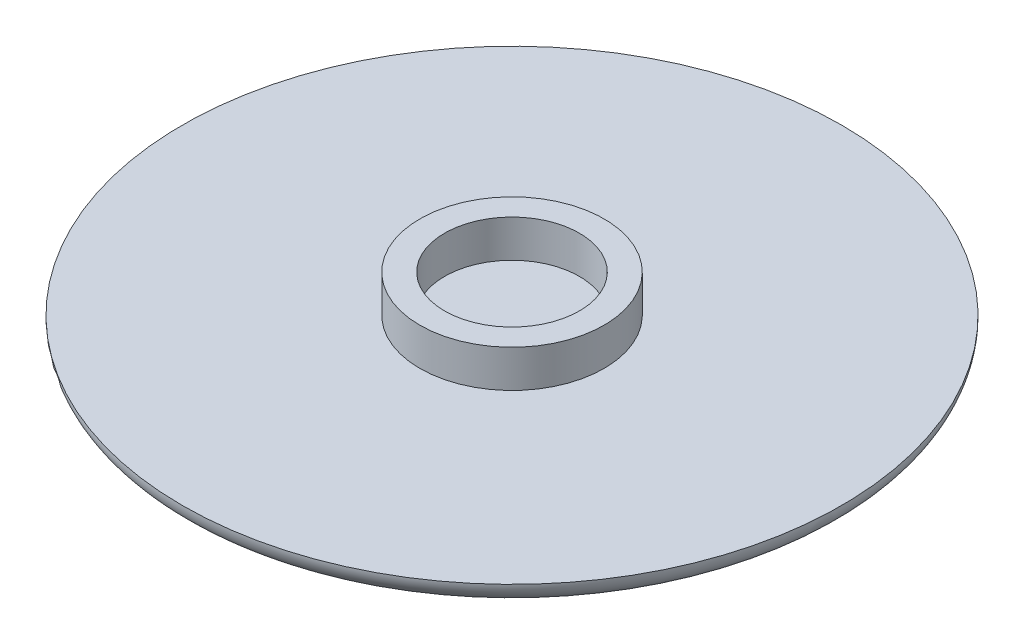
from build123d import *

# Parameters (mm, degrees)
SKETCH_1_R          = 12.3
SKETCH_1_R_2        = 9
EXTRUDE_1_DEPTH     = 5
SKETCH_2_R          = 44
EXTRUDE_2_DEPTH     = 3
FILLET_1_R          = 3
CUT_EXTRUDE_1_DEPTH = 0.4


with BuildPart() as part:
    # Эскиз1 → Бобышка-Вытянуть1 (new body)
    with BuildSketch(Plane(origin=(0, 0, 0), x_dir=(1, 0, 0), z_dir=(0, 1, 0))):
        with Locations(Location((0, 0, 0), (0, 0, 270))):
            Circle(SKETCH_1_R)
        with Locations(Location((0, 0, 0), (0, 0, 270))):
            Circle(SKETCH_1_R_2, mode=Mode.SUBTRACT)
    extrude(amount=EXTRUDE_1_DEPTH)

    # Эскиз2 → Бобышка-Вытянуть2 (add)
    with BuildSketch(Plane.XZ):
        with Locations(Location((0, 0, 0), (0, 0, 270))):
            Circle(SKETCH_2_R)
    extrude(amount=EXTRUDE_2_DEPTH)

    # Скругление1
    fillet_1_edges = [part.edges().sort_by_distance(p)[0] for p in [
        (0, -3, 44),
    ]]
    fillet(fillet_1_edges, radius=FILLET_1_R - 0.0001)  # a hair under: the kernel refuses the full size

    # Эскиз3 → Вырез-Вытянуть1 (cut)
    with BuildSketch(Plane.XZ.offset(3)):
        with BuildLine():
            Line((8.995970712, -6.104573863), (15.540441866, -6.809702068))
            add(Edge.make_bspline(
                [(15.540441866, -6.809702068), (15.412468117, -7.209291312), (15.154055197, -8.016167909), (14.613314091, -9.189585554), (13.958158021, -10.343258865), (13.207970677, -11.497332402), (12.335909119, -12.632612277), (11.33678469, -13.743257832), (10.235946519, -14.845807978), (9.032648574, -15.91638665), (7.753536664, -16.930703687), (6.377129387, -17.80304501), (4.944504921, -18.539269968), (3.454192561, -19.15568009), (1.899553784, -19.624607238), (0.282665391, -19.970371161), (-1.395976393, -20.169412876), (-2.535298753, -20.19445388), (-3.112402685, -20.207137965)],
                knots=[0, 0, 0, 0, 0.821440156, 1.658705401, 2.525323128, 3.419405186, 4.353419828, 5.32681938, 6.344399772, 7.404443113, 8.481060479, 9.538977106, 10.591299887, 11.633537695, 12.694215778, 13.768160887, 14.869500701, 16, 16, 16, 16], degree=3))
            add(Edge.make_bspline(
                [(-3.112402685, -20.207137965), (-3.830059973, -20.180219947), (-5.24950882, -20.126979006), (-7.333765847, -19.748485297), (-9.324321869, -19.100876457), (-11.205038798, -18.21140963), (-12.947033456, -17.089230598), (-14.454993346, -15.681556769), (-15.775431133, -14.076428854), (-16.836564852, -12.230966933), (-17.674056128, -10.211434225), (-18.260978719, -8.036915844), (-18.637890858, -5.732029495), (-18.680542171, -4.148625261), (-18.702346595, -3.339149183)],
                knots=[0, 0, 0, 0, 0.998551589, 1.975027533, 2.936744805, 3.903838964, 4.863557655, 5.807675034, 6.763178998, 7.745855275, 8.758641806, 9.797744155, 10.874151411, 12, 12, 12, 12], degree=3))
            add(Edge.make_bspline(
                [(-18.702346595, -3.339149183), (-18.694827115, -2.798940969), (-18.679761602, -1.716616884), (-18.527910505, -0.102284621), (-18.301586091, 1.502865479), (-17.965102533, 3.090290283), (-17.549772791, 4.670349499), (-17.029049457, 6.231978524), (-16.419967141, 7.784615504), (-15.720819637, 9.310739002), (-14.951153945, 10.78597136), (-14.104651779, 12.165779349), (-13.228965259, 13.463701063), (-12.281997416, 14.653281312), (-11.271614555, 15.73843901), (-10.215647458, 16.72916995), (-9.109657465, 17.6327847), (-7.937840655, 18.421008283), (-6.733157575, 19.121726424), (-5.503022782, 19.73623986), (-4.241088179, 20.242359886), (-2.95541361, 20.657688994), (-1.650714865, 20.995350946), (-0.320069938, 21.221805432), (1.034040545, 21.37348169), (1.947944187, 21.388084339), (2.407429046, 21.395426137)],
                knots=[0, 0, 0, 0, 1.075906032, 2.155611451, 3.227554832, 4.30373447, 5.38628686, 6.480642286, 7.581143633, 8.707391042, 9.82337293, 10.893692135, 11.930684225, 12.940768785, 13.919223559, 14.881988069, 15.823529777, 16.761054785, 17.692163021, 18.598508727, 19.497917784, 20.397951545, 21.288749041, 22.180057169, 23.084984307, 24, 24, 24, 24], degree=3))
            add(Edge.make_bspline(
                [(2.407429046, 21.395426137), (2.984709253, 21.38436262), (4.110243009, 21.362791879), (5.755422445, 21.146858145), (7.309280074, 20.798674498), (8.776183147, 20.306894686), (10.163630571, 19.698295383), (11.445405048, 18.914546867), (12.642602428, 18.007561118), (13.744215102, 16.970925789), (14.740391422, 15.815186826), (15.5940589, 14.539264454), (16.346732625, 13.178856469), (16.935563309, 11.70304546), (17.399883233, 10.131680694), (17.72749797, 8.457159294), (17.928240109, 6.684462125), (17.952122631, 5.468151048), (17.964320071, 4.846948573)],
                knots=[0, 0, 0, 0, 1.079196217, 2.10412856, 3.097265039, 4.052997914, 4.993829394, 5.924450447, 6.855882321, 7.798592485, 8.748507102, 9.702980304, 10.665060364, 11.651045023, 12.668191174, 13.725659051, 14.838433479, 16, 16, 16, 16], degree=3))
            add(Edge.make_bspline(
                [(17.964320071, 4.846948573), (17.939861422, 3.857360897), (17.890041697, 1.84167366), (17.596116304, -0.153181552), (17.446491546, -1.168676427)],
                knots=[0, 0, 0, 0, 0.981886135, 2, 2, 2, 2], degree=3))
            Line((17.446491546, -1.168676427), (-11.651064544, -1.168676427))
            add(Edge.make_bspline(
                [(-11.651064544, -1.168676427), (-11.757884651, -1.36504795), (-11.95927427, -1.735270255), (-12.188010225, -2.298230913), (-12.326177646, -2.83296849), (-12.346562226, -3.184220667), (-12.356192749, -3.350166811)],
                knots=[0, 0, 0, 0, 1.156942796, 2.181202349, 3.140724307, 4, 4, 4, 4], degree=3))
            add(Edge.make_bspline(
                [(-12.356192749, -3.350166811), (-12.34747649, -3.820530136), (-12.330558483, -4.733491811), (-12.207588937, -6.058525833), (-12.012779093, -7.30055293), (-11.73295496, -8.457242596), (-11.349108398, -9.521277255), (-10.912446511, -10.511594722), (-10.387891199, -11.419433456), (-9.762517234, -12.22046917), (-9.095103061, -12.940939566), (-8.37345163, -13.553599554), (-7.633662355, -14.094798444), (-6.845003469, -14.527977227), (-6.01676525, -14.853496387), (-5.158998119, -15.10327405), (-4.2632374, -15.248645974), (-3.652782517, -15.263647049), (-3.343772877, -15.271240529)],
                knots=[0, 0, 0, 0, 1.346284225, 2.613098929, 3.805631801, 4.942804233, 6.013450698, 7.039235158, 8.038108926, 9.00533571, 9.942442562, 10.84439418, 11.710848438, 12.56244313, 13.41163356, 14.253504373, 15.115931414, 16, 16, 16, 16], degree=3))
            add(Edge.make_bspline(
                [(-3.343772877, -15.271240529), (-2.749342022, -15.245702869), (-1.550628193, -15.194204288), (0.219580647, -14.702324431), (1.984521743, -13.976401138), (3.39348022, -13.111143469), (4.503332391, -12.310342129), (5.279497704, -11.607205665), (6.028705195, -10.857717747), (6.714675872, -10.028152313), (7.372080008, -9.148002655), (7.963425509, -8.192752467), (8.520742644, -7.181562683), (8.836014409, -6.467075917), (8.995970712, -6.104573863)],
                knots=[0, 0, 0, 0, 1.313044299, 2.647851039, 4.03980324, 5.527339259, 6.29475363, 7.066375866, 7.842396062, 8.63863277, 9.446691243, 10.272184996, 11.123375662, 12, 12, 12, 12], degree=3))
        make_face()
        with BuildLine():
            Line((-10.57133698, 3.767221009), (11.585113341, 3.767221009))
            add(Edge.make_bspline(
                [(11.585113341, 3.767221009), (11.593025495, 4.083048202), (11.606273104, 4.611849202), (11.614751545, 5.140746771), (11.618166225, 5.353759471)],
                knots=[0, 0, 0, 0, 1.194503009, 2, 2, 2, 2], degree=3))
            add(Edge.make_bspline(
                [(11.618166225, 5.353759471), (11.607865414, 5.787266581), (11.587754302, 6.633637755), (11.485258286, 7.865088987), (11.282712763, 9.016930024), (11.014497534, 10.093427235), (10.643340787, 11.084224083), (10.22296171, 12.00905194), (9.693440715, 12.841121184), (9.10342503, 13.5981791), (8.450495006, 14.275095215), (7.747736216, 14.858424007), (6.995642953, 15.349517378), (6.205542288, 15.762387273), (5.357586525, 16.065155124), (4.475125766, 16.303564325), (3.542488324, 16.434420376), (2.907267946, 16.451055439), (2.583711097, 16.459528702)],
                knots=[0, 0, 0, 0, 1.288915635, 2.516454775, 3.668675548, 4.762204166, 5.808675246, 6.809806692, 7.776046417, 8.732555008, 9.659000055, 10.566141369, 11.441184925, 12.324901883, 13.209090714, 14.112018255, 15.038334656, 16, 16, 16, 16], degree=3))
            add(Edge.make_bspline(
                [(2.583711097, 16.459528702), (2.226745831, 16.453545839), (1.52033684, 16.441706179), (0.475354062, 16.270793025), (-0.551481717, 16.041052654), (-1.545895478, 15.676402937), (-2.521085999, 15.236321875), (-3.474458828, 14.69783397), (-4.385955956, 14.033830496), (-5.29217066, 13.304160782), (-6.156416477, 12.463653114), (-6.953362323, 11.511724736), (-7.714463763, 10.47410691), (-8.384666445, 9.319187587), (-9.037211223, 8.085112247), (-9.596912384, 6.732446378), (-10.136432386, 5.293123636), (-10.424137331, 4.283684469), (-10.57133698, 3.767221009)],
                knots=[0, 0, 0, 0, 0.867869597, 1.717452491, 2.571772394, 3.425671253, 4.289803496, 5.174634535, 6.084973587, 7.031591473, 8.005136717, 9.013559597, 10.050697067, 11.133079613, 12.260592687, 13.446148552, 14.693362615, 16, 16, 16, 16], degree=3))
        make_face(mode=Mode.SUBTRACT)
    extrude(amount=-CUT_EXTRUDE_1_DEPTH, mode=Mode.SUBTRACT)


solid = part.part
